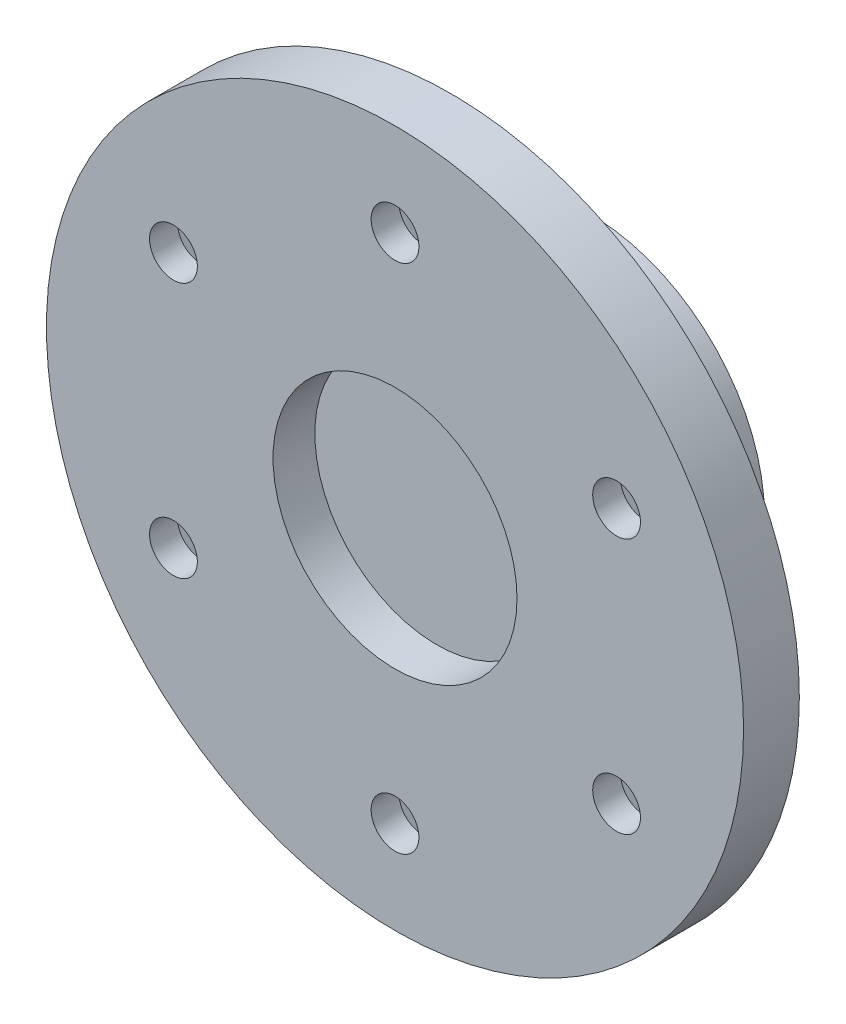
from build123d import *

# Parameters (mm, degrees)
SKETCH1_R           = 25
BOSS_EXTRUDE1_DEPTH = 4
SKETCH2_R           = 1.713577746
CUT_EXTRUDE1_DEPTH  = 4
CUT_EXTRUDE2_DEPTH  = 2
SKETCH4_R           = 12.5
SKETCH4_R_2         = 3
BOSS_EXTRUDE2_DEPTH = 10
SKETCH5_R           = 1.6
CUT_EXTRUDE3_DEPTH  = 12.5
SKETCH6_R           = 3.1
CUT_EXTRUDE4_DEPTH  = 6
FILLET1_R           = 1.5
SKETCH9_R           = 8.75
CUT_EXTRUDE6_DEPTH  = 3
SKETCH12_W          = 5.5
SKETCH12_H          = 2.5
CUT_EXTRUDE7_DEPTH  = 10


with BuildPart() as part:
    # Sketch1 → Boss-Extrude1 (new body)
    with BuildSketch(Plane.XY):
        Circle(SKETCH1_R)
    extrude(amount=BOSS_EXTRUDE1_DEPTH)

    # Sketch2 → Cut-Extrude1 (cut)
    with BuildSketch(Plane(origin=(0, 0, 0), x_dir=(-1, 0, 0), z_dir=(0, 0, -1))):
        with Locations((0, 18.35)):
            Circle(SKETCH2_R)
        with Locations((15.891566159, 9.175)):
            Circle(SKETCH2_R)
        with Locations((15.891566159, -9.175)):
            Circle(SKETCH2_R)
        with Locations((0, -18.35)):
            Circle(SKETCH2_R)
        with Locations((-15.891566159, -9.175)):
            Circle(SKETCH2_R)
        with Locations((-15.891566159, 9.175)):
            Circle(SKETCH2_R)
    extrude(amount=-CUT_EXTRUDE1_DEPTH, mode=Mode.SUBTRACT)

    # Sketch3 → Cut-Extrude2 (cut)
    with BuildSketch(Plane(origin=(0, 0, 0), x_dir=(-1, 0, 0), z_dir=(0, 0, -1))):
        Polygon((13.870840217, 5.675), (17.912292102, 5.675), (19.933018044, 9.175), (17.912292102, 12.675), (13.870840217, 12.675), (11.850114275, 9.175), align=None)
        Polygon((4.041451884, 18.35), (2.020725942, 21.85), (-2.020725942, 21.85), (-4.041451884, 18.35), (-2.020725942, 14.85), (2.020725942, 14.85), align=None)
        Polygon((11.850114275, -9.175), (13.870840217, -12.675), (17.912292102, -12.675), (19.933018044, -9.175), (17.912292102, -5.675), (13.870840217, -5.675), align=None)
        Polygon((-2.020725942, -14.85), (-4.041451884, -18.35), (-2.020725942, -21.85), (2.020725942, -21.85), (4.041451884, -18.35), (2.020725942, -14.85), align=None)
        Polygon((-13.870840217, -5.675), (-17.912292102, -5.675), (-19.933018044, -9.175), (-17.912292102, -12.675), (-13.870840217, -12.675), (-11.850114275, -9.175), align=None)
        Polygon((-11.850114275, 9.175), (-13.870840217, 12.675), (-17.912292102, 12.675), (-19.933018044, 9.175), (-17.912292102, 5.675), (-13.870840217, 5.675), align=None)
    extrude(amount=-CUT_EXTRUDE2_DEPTH, mode=Mode.SUBTRACT)

    # Sketch4 → Boss-Extrude2 (add)
    with BuildSketch(Plane(origin=(0, 0, 0), x_dir=(-1, 0, 0), z_dir=(0, 0, -1))):
        Circle(SKETCH4_R)
        with Locations((0, 1)):
            Circle(SKETCH4_R_2, mode=Mode.SUBTRACT)
    extrude(amount=BOSS_EXTRUDE2_DEPTH)

    # Sketch5 → Cut-Extrude3 (cut)
    with BuildSketch(Plane(origin=(0, 12.5, 0), x_dir=(1, 0, 0), z_dir=(0, 1, 0))):
        with Locations((0, 5)):
            Circle(SKETCH5_R)
    extrude(amount=-CUT_EXTRUDE3_DEPTH, mode=Mode.SUBTRACT)

    # Sketch6 → Cut-Extrude4 (cut)
    with BuildSketch(Plane(origin=(0, 12.5, 0), x_dir=(1, 0, 0), z_dir=(0, 1, 0))):
        with Locations((0, 5)):
            Circle(SKETCH6_R)
    extrude(amount=-CUT_EXTRUDE4_DEPTH, mode=Mode.SUBTRACT)

    # Fillet1
    fillet1_edges = [part.edges().sort_by_distance(p)[0] for p in [
        (12.5, 0, 0),
    ]]
    fillet(fillet1_edges, radius=FILLET1_R)

    # Sketch9 → Cut-Extrude6 (cut)
    with BuildSketch(Plane.XY.offset(4)):
        Circle(SKETCH9_R)
    extrude(amount=-CUT_EXTRUDE6_DEPTH, mode=Mode.SUBTRACT)

    # Sketch12 → Cut-Extrude7 (cut)
    with BuildSketch(Plane(origin=(0, 0, -10), x_dir=(-1, 0, 0), z_dir=(0, 0, -1))):
        with Locations((0, 3.25)):
            Rectangle(SKETCH12_W, SKETCH12_H)
    extrude(amount=-CUT_EXTRUDE7_DEPTH, mode=Mode.SUBTRACT)


solid = part.part
